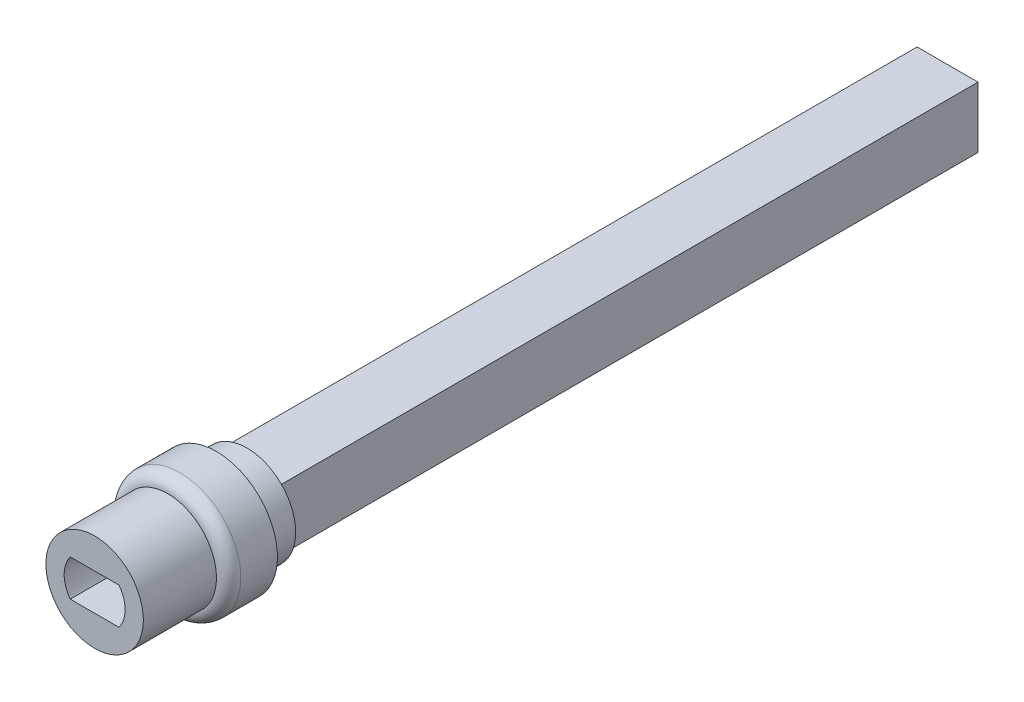
from build123d import *

# Parameters (mm, degrees)
ESQUISSE1_R        = 4
BOSS_EXTRU_1_DEPTH = 6
ESQUISSE2_R        = 5
BOSS_EXTRU_2_DEPTH = 4
CONG_1_R           = 1
ESQUISSE3_W        = 5
ESQUISSE3_H        = 5
BOSS_EXTRU_3_DEPTH = 60
BOSS_EXTRU_4_START = 2.5
ESQUISSE4_R        = 4
BOSS_EXTRU_4_DEPTH = 2.5


with BuildPart() as part:
    # Esquisse1 → Boss.-Extru.1 (new body)
    with BuildSketch(Plane.XY):
        Circle(ESQUISSE1_R)
        with BuildLine():
            Line((-2, 1.5), (2, 1.5))
            ThreePointArc((2, 1.5), (2.5, 0), (2, -1.5))
            Line((2, -1.5), (-2, -1.5))
            ThreePointArc((-2, -1.5), (-2.5, 0), (-2, 1.5))
        make_face(mode=Mode.SUBTRACT)
    extrude(amount=BOSS_EXTRU_1_DEPTH)

    # Esquisse2 → Boss.-Extru.2 (add)
    with BuildSketch(Plane(origin=(0, 0, 0), x_dir=(-1, 0, 0), z_dir=(0, 0, -1))):
        Circle(ESQUISSE2_R)
    extrude(amount=BOSS_EXTRU_2_DEPTH)

    # Congé1
    cong_1_edges = [part.edges().sort_by_distance(p)[0] for p in [
        (5, 0, 0),
    ]]
    fillet(cong_1_edges, radius=CONG_1_R - 0.0001)  # a hair under: the kernel refuses the full size

    # Esquisse3 → Boss.-Extru.3 (add)
    with BuildSketch(Plane(origin=(0, 0, -4), x_dir=(-1, 0, 0), z_dir=(0, 0, -1))):
        Rectangle(ESQUISSE3_W, ESQUISSE3_H)
    extrude(amount=BOSS_EXTRU_3_DEPTH)

    # Esquisse4 → Boss.-Extru.4 (add)
    with BuildSketch(Plane(origin=(0, 0, -4), x_dir=(-1, 0, 0), z_dir=(0, 0, -1)).offset(BOSS_EXTRU_4_START)):
        with Locations(Location((0, 0, 0), (0, 0, 180))):
            Circle(ESQUISSE4_R)
    extrude(amount=-BOSS_EXTRU_4_DEPTH)


solid = part.part
